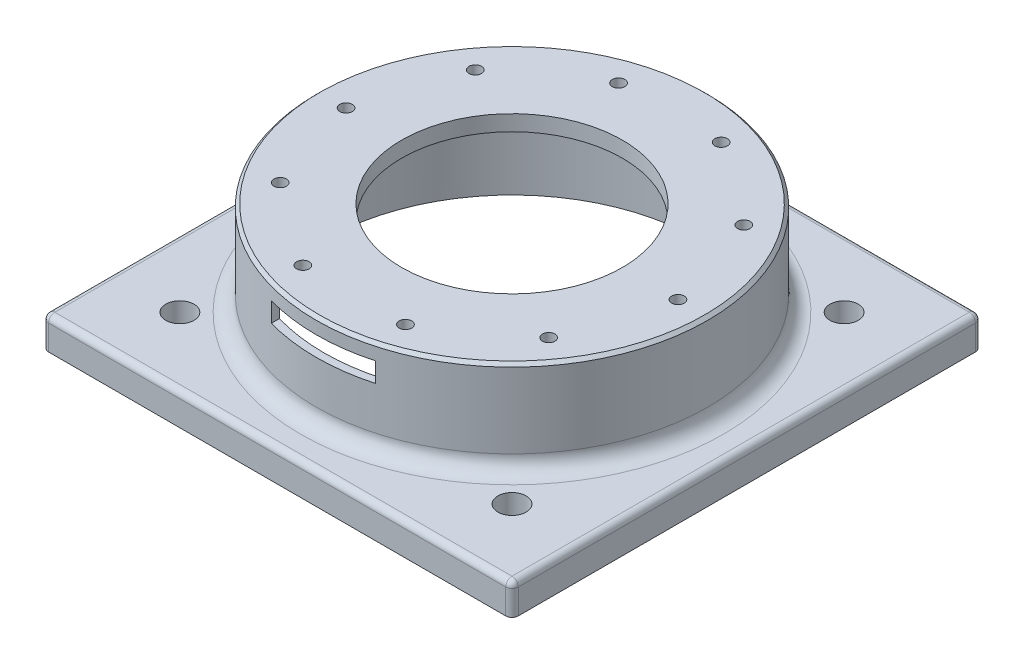
from build123d import *

# Parameters (mm, degrees)
SKETCH_1_W          = 150
SKETCH_1_H          = 150
SKETCH_1_R          = 4.5
EXTRUDE_1_DEPTH     = 10
FILLET_1_R          = 2
FILLET_2_R          = 2
SKETCH_4_R          = 62.5
EXTRUDE_4_DEPTH     = 30
FILLET_5_R          = 5
SKETCH_11_R         = 35.25
CUT_EXTRUDE_2_DEPTH = 114.357840488
SKETCH_10_R         = 60
CUT_EXTRUDE_3_DEPTH = 35
SKETCH_12_R         = 2
CUT_EXTRUDE_4_DEPTH = 114.357840488
CHAMFER_2_SIZE      = 1
SKETCH_14_W         = 33.25
SKETCH_14_H         = 6.25
CUT_EXTRUDE_5_DEPTH = 5


with BuildPart() as part:
    # Эскиз1 → Бобышка-Вытянуть1 (new body)
    with BuildSketch(Plane(origin=(0, 0, 0), x_dir=(1, 0, 0), z_dir=(0, 1, 0))):
        Rectangle(SKETCH_1_W, SKETCH_1_H)
        with Locations((53.033008589, 53.033008589)):
            Circle(SKETCH_1_R, mode=Mode.SUBTRACT)
        with Locations((53.033008589, -53.033008589)):
            Circle(SKETCH_1_R, mode=Mode.SUBTRACT)
        with Locations((-53.033008589, -53.033008589)):
            Circle(SKETCH_1_R, mode=Mode.SUBTRACT)
        with Locations((-53.033008589, 53.033008589)):
            Circle(SKETCH_1_R, mode=Mode.SUBTRACT)
    extrude(amount=EXTRUDE_1_DEPTH)

    # Скругление1
    fillet_1_edges = [part.edges().sort_by_distance(p)[0] for p in [
        (-75, 5, -75),
        (75, 5, -75),
        (-75, 5, 75),
        (75, 5, 75),
    ]]
    fillet(fillet_1_edges, radius=FILLET_1_R)

    # Скругление2
    fillet_2_edges = [part.edges().sort_by_distance(p)[0] for p in [
        (-74.414213562, 10, -74.414213562),
        (74.414213562, 10, -74.414213562),
        (74.414213562, 10, 74.414213562),
        (-74.414213562, 10, 74.414213562),
        (0, 10, 75),
        (75, 10, 0),
        (0, 10, -75),
        (-75, 10, 0),
    ]]
    fillet(fillet_2_edges, radius=FILLET_2_R)

    # Эскиз4 → Бобышка-Вытянуть4 (add)
    with BuildSketch(Plane(origin=(0, 10, 0), x_dir=(1, 0, 0), z_dir=(0, 1, 0))):
        Circle(SKETCH_4_R)
    extrude(amount=EXTRUDE_4_DEPTH)

    # Скругление5
    fillet_5_edges = [part.edges().sort_by_distance(p)[0] for p in [
        (-62.5, 10, 0),
    ]]
    fillet(fillet_5_edges, radius=FILLET_5_R)

    # Эскиз11 → Вырез-Вытянуть2 (cut, through all)
    with BuildSketch(Plane(origin=(0, 40, 0), x_dir=(1, 0, 0), z_dir=(0, 1, 0))):
        Circle(SKETCH_11_R)
    extrude(amount=-CUT_EXTRUDE_2_DEPTH, mode=Mode.SUBTRACT)

    # Эскиз10 → Вырез-Вытянуть3 (cut)
    with BuildSketch(Plane.XZ):
        Circle(SKETCH_10_R)
    extrude(amount=-CUT_EXTRUDE_3_DEPTH, mode=Mode.SUBTRACT)

    # Эскиз12 → Вырез-Вытянуть4 (cut, through all)
    with BuildSketch(Plane(origin=(0, 40, 0), x_dir=(1, 0, 0), z_dir=(0, 1, 0))):
        with Locations((-53, 0)):
            Circle(SKETCH_12_R)
        with Locations((-42.877900702, 31.152618372)):
            Circle(SKETCH_12_R)
        with Locations((-16.377900702, 50.405995364)):
            Circle(SKETCH_12_R)
        with Locations((16.377900702, 50.405995364)):
            Circle(SKETCH_12_R)
        with Locations((42.877900702, 31.152618372)):
            Circle(SKETCH_12_R)
        with Locations((53, 0)):
            Circle(SKETCH_12_R)
        with Locations((42.877900702, -31.152618372)):
            Circle(SKETCH_12_R)
        with Locations((16.377900702, -50.405995364)):
            Circle(SKETCH_12_R)
        with Locations((-16.377900702, -50.405995364)):
            Circle(SKETCH_12_R)
        with Locations((-42.877900702, -31.152618372)):
            Circle(SKETCH_12_R)
    extrude(amount=-CUT_EXTRUDE_4_DEPTH, mode=Mode.SUBTRACT)

    # Фаска2
    chamfer_2_edges = [part.edges().sort_by_distance(p)[0] for p in [
        (-62.5, 40, 0),
    ]]
    chamfer(chamfer_2_edges, length=CHAMFER_2_SIZE)

    # Эскиз14 → Вырез-Вытянуть5 (cut)
    with BuildSketch(Plane.XY.offset(62.5)):
        with Locations((0, 31.875)):
            Rectangle(SKETCH_14_W, SKETCH_14_H)
    extrude(amount=-CUT_EXTRUDE_5_DEPTH, mode=Mode.SUBTRACT)


solid = part.part
